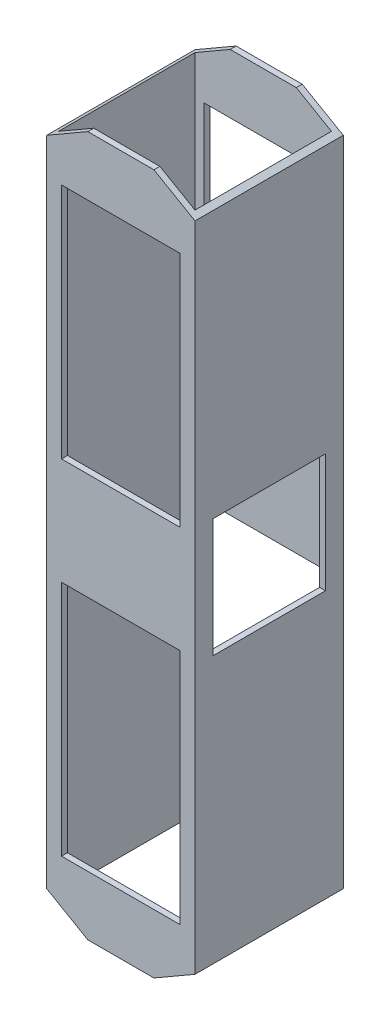
from build123d import *

# Parameters (mm, degrees)
CROQUIS1_W              = 25
CROQUIS1_H              = 118
SALIENTE_EXTRUIR1_DEPTH = 25
VACIADO1_T              = -1
CORTAR_EXTRUIR2_DEPTH   = 25
CROQUIS3_W              = 19
CROQUIS3_H              = 20
CORTAR_EXTRUIR3_DEPTH   = 1
CHAFL_N1_SIZE           = 4
CHAFL_N1_SIZE_2         = 6.92820323
CHAFL_N2_SIZE           = 6.92820323
CHAFL_N2_SIZE_2         = 4


with BuildPart() as part:
    # Croquis1 → Saliente-Extruir1 (new body)
    with BuildSketch(Plane.XY):
        with Locations((-22.555898832, -39.876814203)):
            Rectangle(CROQUIS1_W, CROQUIS1_H)
    extrude(amount=SALIENTE_EXTRUIR1_DEPTH)

    # Vaciado1
    vaciado1_openings = [part.faces().sort_by_distance(p)[0] for p in [
        (-22.555898832, -98.876814203, 12.5),
        (-22.555898832, 19.123185797, 12.5),
    ]]
    offset(amount=VACIADO1_T, openings=vaciado1_openings, kind=Kind.INTERSECTION)

    # Croquis2 → Cortar-Extruir2 (cut)
    with BuildSketch(Plane.XY.offset(25)):
        Polygon((-12.555898832, -30.876814203), (-32.555898832, -30.876814203), (-32.555898832, 9.123185797), (-22.555898832, 9.123185797), (-12.555898832, 9.123185797), align=None)
        Polygon((-12.555898832, -88.876814203), (-12.555898832, -48.876814203), (-32.555898832, -48.876814203), (-32.555898832, -88.876814203), (-22.555898832, -88.876814203), align=None)
    extrude(amount=-CORTAR_EXTRUIR2_DEPTH, mode=Mode.SUBTRACT)

    # Croquis3 → Cortar-Extruir3 (cut)
    with BuildSketch(Plane(origin=(-10.055898832, 0, 0), x_dir=(0, 0, -1), z_dir=(1, 0, 0))):
        with Locations((-12.5, -39.876814203)):
            Rectangle(CROQUIS3_W, CROQUIS3_H)
    extrude(amount=-CORTAR_EXTRUIR3_DEPTH, mode=Mode.SUBTRACT)

    # Chaflán1
    # the kernel refuses this chamfer: 6.92820323, 4 mm, written as the material it takes off along each edge
    with BuildSketch(Plane(origin=(-35.055898832, 19.123185797, -17.923855882), x_dir=(0, -1, 0), z_dir=(0, 0, 1))) as chafl_n1_piece_1:
        Polygon((CHAFL_N1_SIZE, 0), (0, CHAFL_N1_SIZE_2), (0, 0), align=None)
    extrude(amount=60.847711765, mode=Mode.SUBTRACT)
    with BuildSketch(Plane(origin=(-10.055898832, 19.123185797, -17.923855882), x_dir=(-1, 0, 0), z_dir=(0, 0, 1))) as chafl_n1_piece_2:
        Polygon((CHAFL_N1_SIZE_2, 0), (0, CHAFL_N1_SIZE), (0, 0), align=None)
    extrude(amount=60.847711765, mode=Mode.SUBTRACT)

    # Chaflán2
    # the kernel refuses this chamfer: 6.92820323, 4 mm, written as the material it takes off along each edge
    with BuildSketch(Plane(origin=(-10.055898832, -98.876814203, -17.923855882), x_dir=(-1, 0, 0), z_dir=(0, 0, 1))) as chafl_n2_piece_1:
        Polygon((CHAFL_N2_SIZE, 0), (0, -CHAFL_N2_SIZE_2), (0, 0), align=None)
    extrude(amount=60.847711765, mode=Mode.SUBTRACT)
    with BuildSketch(Plane(origin=(-35.055898832, -98.876814203, -17.923855882), x_dir=(0, 1, 0), z_dir=(0, 0, 1))) as chafl_n2_piece_2:
        Polygon((CHAFL_N2_SIZE_2, 0), (0, -CHAFL_N2_SIZE), (0, 0), align=None)
    extrude(amount=60.847711765, mode=Mode.SUBTRACT)


solid = part.part
